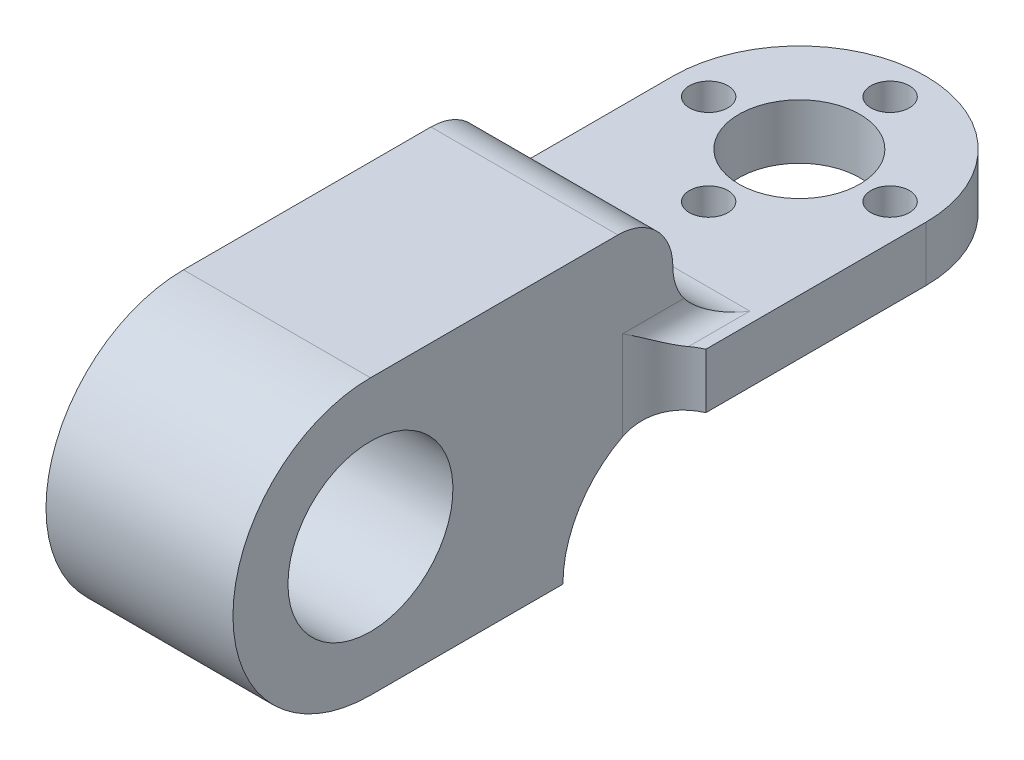
from build123d import *

# Parameters (mm, degrees)
SKETCH1_R           = 11.5
SKETCH1_R_2         = 5.5
SKETCH1_R_3         = 1.75
SKETCH1_R_4         = 1.7499999999999998
EXTRUDE1_DEPTH      = 5
EXTRUDE2_DEPTH      = 40
FILLET1_RADIUS      = 12.5
FILLET1_LENGTH      = 17
EXTRUDE4_REACH      = 46.241
EXTRUDE4_END_RADIUS = 11.5
SKETCH4_W           = 23
SKETCH4_H           = 5
SKETCH5_R           = 7.499999999999999
EXTRUDE5_DEPTH      = 66
FILLET2_R           = 5
EXTRUDE6_DEPTH      = 66
EXTRUDE6_DEPTH_BACK = 66
FILLET3_R           = 5
FILLET4_R           = 2


# Some blends are built 0.0001 mm under size
with BuildPart() as part:
    # Sketch1 → Extrude1 (new body)
    with BuildSketch(Plane(origin=(0, 0, 0), x_dir=(1, 0, 0), z_dir=(0, 1, 0))):
        with Locations(Location((0, 0, 0), (0, 0, 270))):
            Circle(SKETCH1_R)
        with Locations(Location((0, 0, 0), (0, 0, 270))):
            Circle(SKETCH1_R_2, mode=Mode.SUBTRACT)
        with Locations(Location((-8.25, 0, 0), (0, 0, 270))):
            Circle(SKETCH1_R_3, mode=Mode.SUBTRACT)
        with Locations(Location((2.88e-14, 8.249999999999998, 0), (0, 0, 270))):
            Circle(SKETCH1_R_3, mode=Mode.SUBTRACT)
        with Locations(Location((8.25, -5.761e-14, 0), (0, 0, 270))):
            Circle(SKETCH1_R_4, mode=Mode.SUBTRACT)
        with Locations(Location((-8.641e-14, -8.25, 0), (0, 0, 270))):
            Circle(SKETCH1_R_4, mode=Mode.SUBTRACT)
    extrude(amount=EXTRUDE1_DEPTH)



with BuildPart() as body_2:
    # Sketch2 → Extrude2 (new body)
    with BuildSketch(Plane.XY.offset(20)):
        Polygon((-8.5, 15.000000000000002), (8.499999999999996, 15.000000000000002), (8.500000000000002, -10), (-8.499999999999998, -10), align=None)
    extrude(amount=EXTRUDE2_DEPTH)

    # Fillet1: full round fillet: the end face becomes a half cylinder, R = half its width
    fillet1_face = Plane((0, 2.5, 60), x_dir=(1, 0, 0), z_dir=(0, 0, 1))  # on the end face: x along it, z out of the body
    fillet1_slab = fillet1_face.offset(-FILLET1_RADIUS / 2) * Box(FILLET1_LENGTH, 2 * FILLET1_RADIUS, FILLET1_RADIUS, mode=Mode.PRIVATE)  # the body's end, R deep
    fillet1_round = Plane((0, 2.5, 47.5), x_dir=(0, 0, 1), z_dir=(1, 0, 0)) * Cylinder(FILLET1_RADIUS, FILLET1_LENGTH, mode=Mode.PRIVATE)  # its axis R under the face
    add(fillet1_slab - fillet1_round, mode=Mode.SUBTRACT)


with BuildPart() as part_1:
    add(part.part)

    add(body_2.part)  # Extrude4 merges body 2
    # Extrude4: up to this cylinder (the profile starts outside it)
    extrude4_end = Plane(origin=(0, 2.5, 0), z_dir=(0, -1, 0)) * Cylinder(EXTRUDE4_END_RADIUS, 116.482, mode=Mode.PRIVATE)
    # Sketch4 → Extrude4 (add, up to the surface)
    with BuildSketch(Plane(origin=(0, 0, 20), x_dir=(-1, 0, 0), z_dir=(0, 0, -1)), mode=Mode.PRIVATE) as extrude4_sk1:
        with Locations((0, 2.5)):
            Rectangle(SKETCH4_W, SKETCH4_H)
    extrude4_tool1 = extrude(extrude4_sk1.sketch, amount=EXTRUDE4_REACH, mode=Mode.PRIVATE) - extrude4_end
    add(extrude4_tool1.solids().sort_by_distance((0, 2.5, 20))[0])

    # Sketch5 → Extrude5 (cut, through all)
    with BuildSketch(Plane.ZY.offset(8.499999999999998)):
        with Locations((47.5, 2.5000000000000004)):
            Circle(SKETCH5_R)
    extrude(amount=-EXTRUDE5_DEPTH, mode=Mode.SUBTRACT)

    # Fillet2
    fillet2_edges = [part_1.edges().sort_by_distance(p)[0] for p in [
        (0, 5, 20),
    ]]
    fillet(fillet2_edges, radius=FILLET2_R)
    fillet2_2_edges = [part_1.edges().sort_by_distance(p)[0] for p in [
        (-1.78e-15, 15.000000000000002, 20),
    ]]
    fillet(fillet2_2_edges, radius=FILLET2_R - 0.0001)  # a hair under: the kernel refuses the full size

    # Sketch6 → Extrude6 (cut, two sides: drawn at the far end of the back side and taken through both)
    with BuildSketch(Plane.ZY.offset(8.499999999999998).offset(-EXTRUDE6_DEPTH_BACK)):
        with BuildLine():
            Line((-86.89685237405806, -7.595e-14), (20, 0))
            ThreePointArc((20, 0), (27.071067811865476, -2.9289321881345254), (30, -10.000000000000002))
            Line((30, -10.000000000000002), (29.999999999999982, -116.89685237405806))
            Line((29.999999999999982, -116.89685237405806), (-121.17497840238745, -268.0718307764456))
            Line((-121.17497840238745, -268.0718307764456), (-238.0718307764455, -151.1749784023876))
            Line((-238.0718307764455, -151.1749784023876), (-86.89685237405806, -7.595e-14))
        make_face()
    extrude(amount=EXTRUDE6_DEPTH + EXTRUDE6_DEPTH_BACK, mode=Mode.SUBTRACT)

    # Fillet3
    # the kernel refuses this fillet: 5 mm, written as the material it adds along each edge
    with BuildSketch(Plane(origin=(8.499999999999998, 5, 20), x_dir=(0, 0, 1), z_dir=(2.1e-16, -1, 0))) as fillet3_piece_1_section:
        with BuildLine():
            CenterArc((4.5825756949558425, -5), FILLET3_R, 90, 66.4218215217982)
            Line((0, -3.0000000000000018), (0, 0))
            Line((0, 0), (4.5825756949558425, 0))
        make_face()
    fillet3_piece_1 = extrude(amount=16.45643923738961, mode=Mode.PRIVATE)
    fillet3_piece_1 = fillet3_piece_1 - Plane(origin=(9.308333267064283, -10.000000000000004, 19.999999999999996), x_dir=(0, 1, 3.6e-16), z_dir=(1, 0, 0)) * Cylinder(10.000000000000004, 52, mode=Mode.PRIVATE)
    add(fillet3_piece_1)
    with BuildSketch(Plane(origin=(-8.499999999999998, -11.456439237389606, 20), x_dir=(0, 0, 1), z_dir=(-7e-17, 1, 0))) as fillet3_piece_2_section:
        with BuildLine():
            CenterArc((4.5825756949558425, -5), FILLET3_R, 90, 66.4218215217982)
            Line((0, -3.0000000000000018), (0, 0))
            Line((0, 0), (4.5825756949558425, 0))
        make_face()
    fillet3_piece_2 = extrude(amount=16.456439237389606, mode=Mode.PRIVATE)
    fillet3_piece_2 = fillet3_piece_2 - Plane(origin=(-8.583224495068782, -10.000000000000004, 19.999999999999996), x_dir=(0, 1, 3.6e-16), z_dir=(1, 0, 0)) * Cylinder(10.000000000000004, 52, mode=Mode.PRIVATE)
    add(fillet3_piece_2)

    # Fillet4
    fillet4_edges = [part_1.edges().sort_by_distance(p)[0] for p in [
        (-8.5, 5, 19.791287847478),
        (8.5, 5, 19.791287847478),
    ]]
    fillet(fillet4_edges, radius=FILLET4_R)


solid = part_1.part
